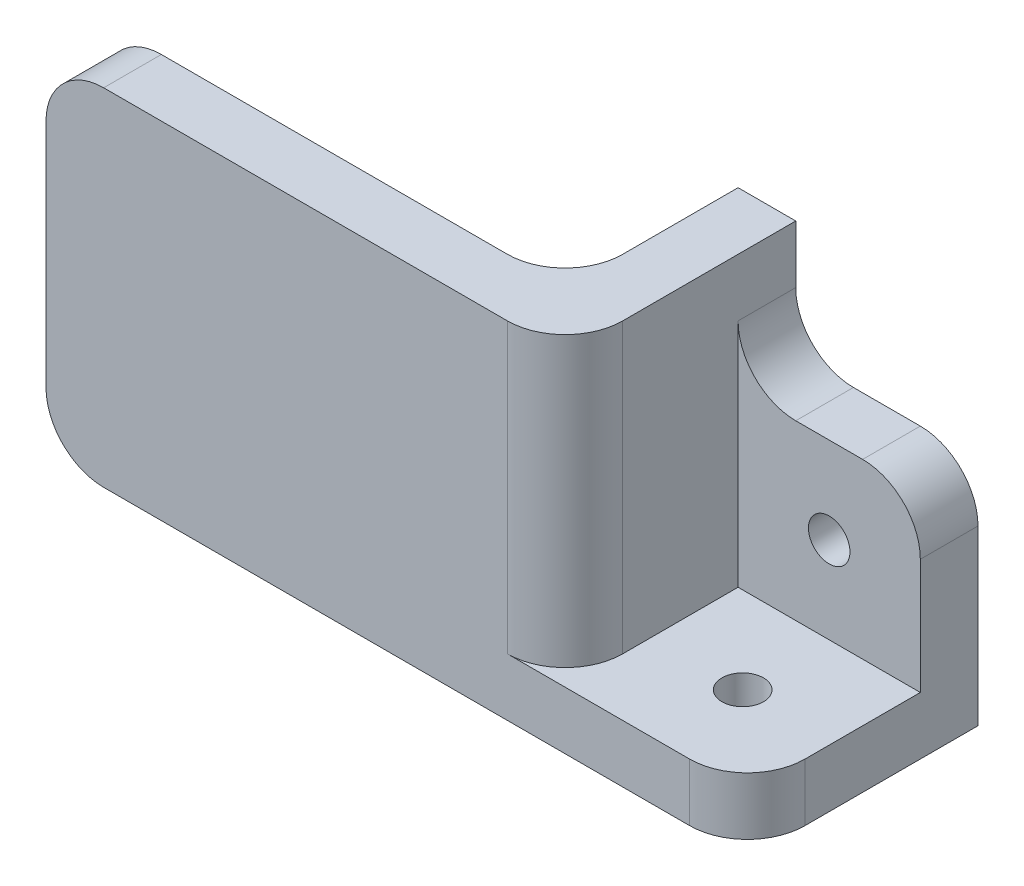
from build123d import *

# Parameters (mm, degrees)
SKETCH1_W           = 20.066
SKETCH1_H           = 25.4
BOSS_EXTRUDE1_DEPTH = 6.35
SKETCH2_W           = 20.066
SKETCH2_H           = 25.4
BOSS_EXTRUDE2_DEPTH = 6.35
SKETCH3_W           = 25.4
SKETCH3_H           = 38.1
BOSS_EXTRUDE3_DEPTH = 6.35
SKETCH4_W           = 50.8
SKETCH4_H           = 38.1
BOSS_EXTRUDE4_DEPTH = 6.35
SKETCH6_R           = 2.286
CUT_EXTRUDE1_DEPTH  = 80.549154546
SKETCH7_R           = 2.286
CUT_EXTRUDE2_DEPTH  = 76.385064761
FILLET1_R           = 6.35


with BuildPart() as part:
    # Sketch1 → Boss-Extrude1 (new body)
    with BuildSketch(Plane(origin=(0, 0, 0), x_dir=(1, 0, 0), z_dir=(0, 1, 0))):
        Rectangle(SKETCH1_W, SKETCH1_H)
    extrude(amount=BOSS_EXTRUDE1_DEPTH)

    # Sketch2 → Boss-Extrude2 (add)
    with BuildSketch(Plane(origin=(0, 0, -12.7), x_dir=(-1, 0, 0), z_dir=(0, 0, -1))):
        with Locations((0, 12.7)):
            Rectangle(SKETCH2_W, SKETCH2_H)
    extrude(amount=-BOSS_EXTRUDE2_DEPTH)

    # Sketch3 → Boss-Extrude3 (add)
    with BuildSketch(Plane.ZY.offset(10.033)):
        with Locations((0, 19.05)):
            Rectangle(SKETCH3_W, SKETCH3_H)
    extrude(amount=BOSS_EXTRUDE3_DEPTH)

    # Sketch4 → Boss-Extrude4 (add)
    with BuildSketch(Plane.XY.offset(12.7)):
        with Locations((-41.783, 19.05)):
            Rectangle(SKETCH4_W, SKETCH4_H)
    extrude(amount=-BOSS_EXTRUDE4_DEPTH)

    # Sketch6 → Cut-Extrude1 (cut, through all)
    with BuildSketch(Plane.XY.offset(-6.35)):
        with Locations((0, 15.875)):
            Circle(SKETCH6_R)
    extrude(amount=-CUT_EXTRUDE1_DEPTH, mode=Mode.SUBTRACT)

    # Sketch7 → Cut-Extrude2 (cut, through all)
    with BuildSketch(Plane(origin=(0, 6.35, 0), x_dir=(1, 0, 0), z_dir=(0, 1, 0))):
        with Locations((0, -3.175)):
            Circle(SKETCH7_R)
    extrude(amount=-CUT_EXTRUDE2_DEPTH, mode=Mode.SUBTRACT)

    # Fillet1
    fillet1_edges = [part.edges().sort_by_distance(p)[0] for p in [
        (-16.383, 19.05, 6.35),
        (-10.033, 22.225, 12.7),
        (-10.033, 25.4, -9.525),
        (10.033, 25.4, -9.525),
        (10.033, 3.175, 12.7),
        (-67.183, 0, 9.525),
        (-67.183, 38.1, 9.525),
    ]]
    fillet(fillet1_edges, radius=FILLET1_R)


solid = part.part
